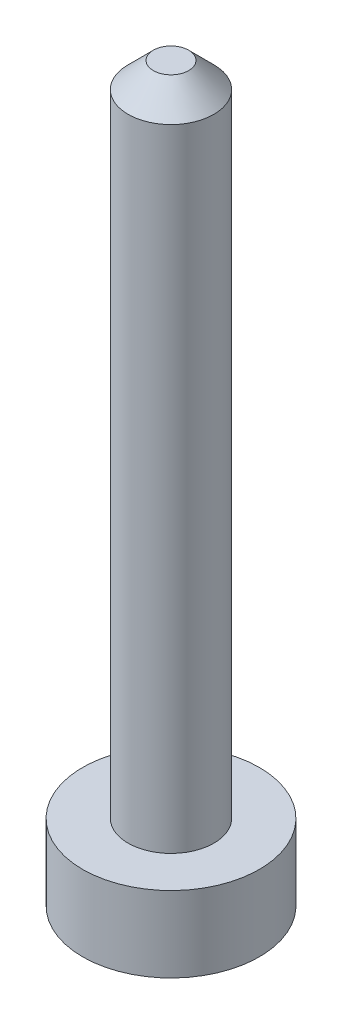
from build123d import *

# Parameters (mm, degrees)
SKETCH_1_R      = 3.5
EXTRUDE_1_DEPTH = 3
SKETCH_1_3_R    = 1.7
EXTRUDE_2_DEPTH = 26
CHAMFER_1_SIZE  = 1


with BuildPart() as part:
    # Эскиз1 → Бобышка-Вытянуть1 (new body)
    with BuildSketch(Plane(origin=(0, 0, 0), x_dir=(1, 0, 0), z_dir=(0, 1, 0))):
        Circle(SKETCH_1_R)
    extrude(amount=-EXTRUDE_1_DEPTH)

    # Эскиз1<3> → Бобышка-Вытянуть2 (add)
    with BuildSketch(Plane(origin=(0, 0, 0), x_dir=(1, 0, 0), z_dir=(0, 1, 0))):
        Circle(SKETCH_1_3_R)
    extrude(amount=EXTRUDE_2_DEPTH)

    # Фаска1
    chamfer_1_edges = [part.edges().sort_by_distance(p)[0] for p in [
        (-1.7, 26, 0),
    ]]
    chamfer(chamfer_1_edges, length=CHAMFER_1_SIZE)


solid = part.part
